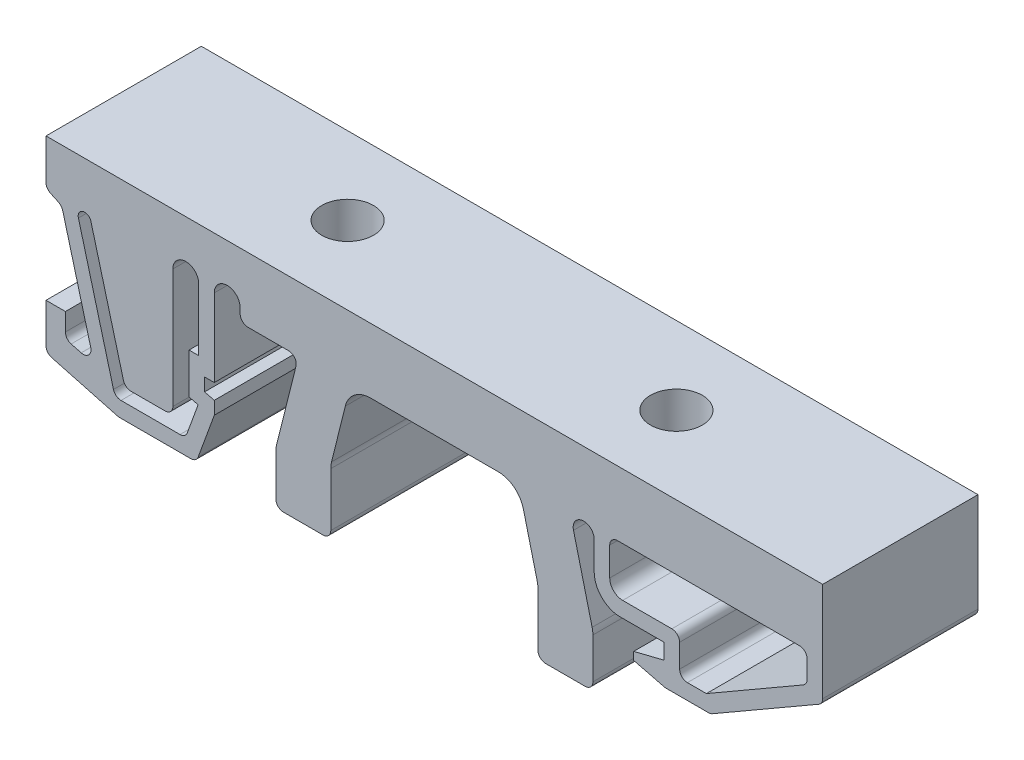
from build123d import *
from OCP.BRepAlgoAPI import BRepAlgoAPI_Cut
from OCP.TopTools import TopTools_ListOfShape

# Parameters (mm, degrees)
BOSS_EXTRUDE1_DEPTH     = 6
CUT_EXTRUDE1_DEPTH      = 35.525353003
CUT_EXTRUDE1_DEPTH_BACK = 35.525353003
FILLET1_R               = 2
FILLET2_R               = 1
FILLET3_R               = 0.811424
FILLET4_R               = 2
FILLET5_R               = 1
FILLET6_R               = 1
FILLET7_R               = 0.5
FILLET8_R               = 0.6
SKETCH4_R               = 2
CUT_EXTRUDE2_DEPTH      = 8.5


with BuildPart() as part:
    # Sketch2 → Boss-Extrude1 (new, symmetric)
    with BuildSketch(Plane.XY):
        Polygon((6.5, 11), (-6.5, 11), (-8, 4.9838286), (-8, 0), (-12.25, 0), (-12.25, 3.981133366), (-10.5, 11), (-15, 11), (-15, 13), (-17, 13), (-17, 6), (-17.75, 6), (-17.75, 5), (-17, 4.813003998), (-17, 3.813003998), (-18.387819958, 0), (-24.387819958, 0), (-30, 1.50377911), (-30, 5.00377911), (-28.5, 5.00377911), (-28.5, 3.172407682), (-26.2783706, 2.577123878), (-28.785442178, 11.933642386), (-30, 12.5), (-30, 16), (0, 16), (30, 16), (30, 8), (21.339745962, 3), (17.839745962, 3), (15.4, 3.608296988), (15.4, 4.214079193), (17.75, 4.8), (17.75, 6), (12.35, 6), (12.35, 11), (10.5, 11), (12.25, 3.981133366), (12.25, 0), (8, 0), (8, 4.9838286), align=None)
    extrude(amount=BOSS_EXTRUDE1_DEPTH, both=True)

    # Sketch3 → Cut-Extrude1 (cut, two sides: drawn at the far end of the back side and taken through both)
    with BuildSketch(Plane.XY.offset(-CUT_EXTRUDE1_DEPTH_BACK)):
        Polygon((-27.626331186, 12.24422524), (-24.667039952, 1.2), (-19.228069004, 1.2), (-18.249764702, 3.88786898), (-18.95, 4.062457248), (-18.95, 7.2), (-18.2, 7.2), (-18.2, 13), (-20.2, 13), (-20.2, 2.2), (-23.899712964, 2.2), (-26.66040536, 12.503044285), align=None)
        Polygon((13.55, 11), (13.55, 7.2), (18.95, 7.2), (18.95, 4.2), (21.018206931, 4.2), (28.8, 8.692820323), (28.8, 11), align=None)
    extrude(amount=CUT_EXTRUDE1_DEPTH + CUT_EXTRUDE1_DEPTH_BACK, mode=Mode.SUBTRACT)

    # Fillet1
    fillet1_edges = [part.edges().sort_by_distance(p)[0] for p in [
        (12.35, 6, 0),
    ]]
    fillet(fillet1_edges, radius=FILLET1_R)

    # Fillet2
    fillet2_edges = [part.edges().sort_by_distance(p)[0] for p in [
        (13.55, 7.2, 0),
    ]]
    fillet(fillet2_edges, radius=FILLET2_R)

    # Fillet3
    fillet3_edges = [part.edges().sort_by_distance(p)[0] for p in [
        (12.35, 11, 0),
        (10.5, 11, 0),
    ]]
    fillet(fillet3_edges, radius=FILLET3_R)

    # Fillet4
    fillet4_edges = [part.edges().sort_by_distance(p)[0] for p in [
        (12.25, 3.981133366, 0),
        (8, 4.9838286, 0),
        (6.5, 11, 0),
        (-6.5, 11, 0),
        (-8, 4.9838286, 0),
        (-12.25, 3.981133366, 0),
    ]]
    fillet(fillet4_edges, radius=FILLET4_R)

    # Fillet5
    fillet5_edges = [part.edges().sort_by_distance(p)[0] for p in [
        (-20.2, 13, 0),
        (-18.2, 13, 0),
    ]]
    fillet(fillet5_edges, radius=FILLET5_R - 0.0001)  # a hair under: the kernel refuses the full size

    # Fillet6
    fillet6_edges = [part.edges().sort_by_distance(p)[0] for p in [
        (-15, 13, 0),
        (-17, 13, 0),
    ]]
    fillet(fillet6_edges, radius=FILLET6_R - 0.0001)  # a hair under: the kernel refuses the full size

    # Fillet7
    fillet7_edges = [part.edges().sort_by_distance(p)[0] for p in [
        (-27.626331186, 12.24422524, 0),
        (-26.66040536, 12.503044285, 0),
    ]]
    fillet(fillet7_edges, radius=FILLET7_R - 0.0001)  # a hair under: the kernel refuses the full size

    # Fillet8
    fillet8_edges = [part.edges().sort_by_distance(p)[0] for p in [
        (-23.899712964, 2.2, 0),
        (-20.2, 2.2, 0),
        (-19.228069004, 1.2, 0),
        (-24.667039952, 1.2, 0),
        (13.55, 11, 0),
        (28.8, 11, 0),
        (28.8, 8.692820323, 0),
        (18.95, 4.2, 0),
        (18.95, 7.2, 0),
        (12.25, 0, 0),
        (8, 0, 0),
        (-8, 0, 0),
        (-12.25, 0, 0),
        (-10.5, 11, 0),
        (-15, 11, 0),
        (-18.387819958, 0, 0),
        (-24.387819958, 0, 0),
        (-30, 1.50377911, 0),
        (-28.5, 3.172407682, 0),
        (-26.2783706, 2.577123878, 0),
        (-28.785442178, 11.933642386, 0),
        (-30, 12.5, 0),
        (30, 8, 0),
        (21.339745962, 3, 0),
        (17.839745962, 3, 0),
    ]]
    fillet(fillet8_edges, radius=FILLET8_R)


with BuildPart() as cut_extrude2_tool:
    # Sketch4 → Cut-Extrude2 (new body)
    with BuildSketch(Plane(origin=(0, 16, 0), x_dir=(1, 0, 0), z_dir=(0, 1, 0))):
        with Locations(Location((-12.7, 0, 0), (0, 0, 270))):
            Circle(SKETCH4_R)
        with Locations(Location((12.7, 0, 0), (0, 0, 261.764287363))):
            Circle(SKETCH4_R)
    extrude(amount=-CUT_EXTRUDE2_DEPTH)


with BuildPart() as part_1:
    add(part.part)

    # Cut-Extrude2: cut by cut_extrude2_tool, with a tolerance
    cut_extrude2_stock = TopTools_ListOfShape()
    cut_extrude2_stock.Append(part_1.part.wrapped)
    cut_extrude2_tools = TopTools_ListOfShape()
    cut_extrude2_tools.Append(cut_extrude2_tool.part.wrapped)
    cut_extrude2_cut = BRepAlgoAPI_Cut()
    cut_extrude2_cut.SetArguments(cut_extrude2_stock)
    cut_extrude2_cut.SetTools(cut_extrude2_tools)
    cut_extrude2_cut.SetFuzzyValue(0.00001)
    cut_extrude2_cut.Build()
    add(Compound.cast(cut_extrude2_cut.Shape()).solids(), mode=Mode.REPLACE)


solid = part_1.part
